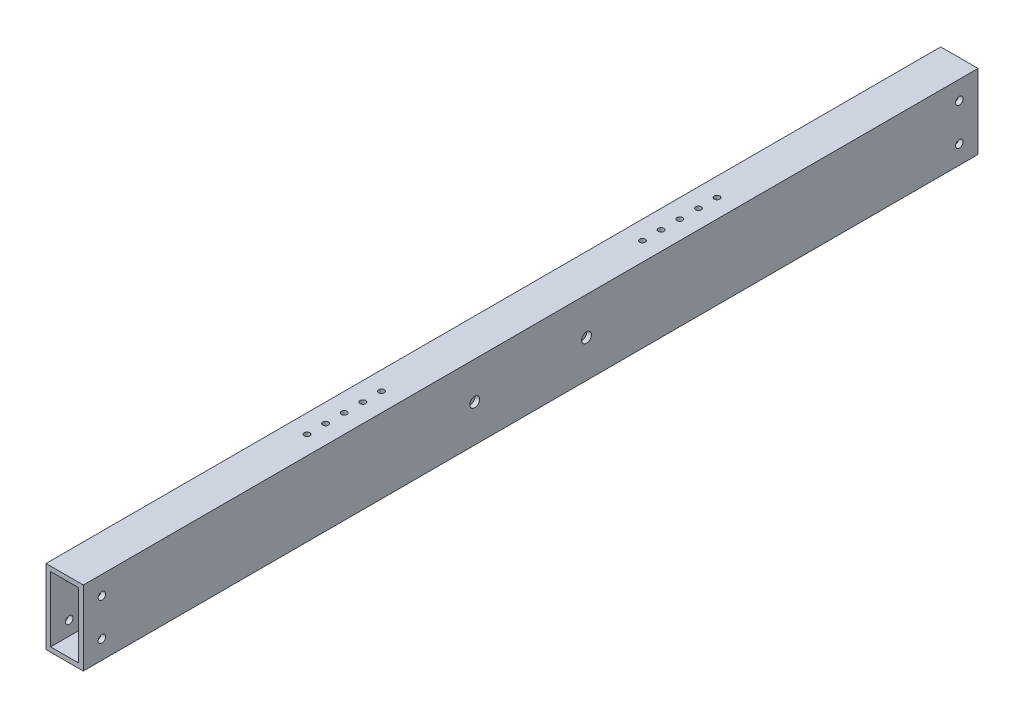
from build123d import *

# Parameters (mm, degrees)
SKETCH1_W               = 25.4
SKETCH1_H               = 50.8
SKETCH1_W_2             = 19.05
SKETCH1_H_2             = 44.45
BOSS_EXTRUDE1_DEPTH     = 304.8
F_10_CLEARANCE_HOLE1_D  = 5.1054
F_1_4_CLEARANCE_HOLE2_D = 6.7564
SKETCH7_R               = 1.905
CUT_EXTRUDE1_DEPTH      = 310.265209812


with BuildPart() as part:
    # Sketch1 → Boss-Extrude1 (new, symmetric)
    with BuildSketch(Plane.XY):
        Rectangle(SKETCH1_W, SKETCH1_H)
        Rectangle(SKETCH1_W_2, SKETCH1_H_2, mode=Mode.SUBTRACT)
    extrude(amount=BOSS_EXTRUDE1_DEPTH, both=True)

    # #10 Clearance Hole1 (through all)
    with Locations(Plane(origin=(12.7, 0, 0), x_dir=(0, 0, -1), z_dir=(1, 0, 0))):
        with Locations((-292.1, 12.7), (-292.1, -12.7)):
            f_10_clearance_hole1 = Hole(F_10_CLEARANCE_HOLE1_D / 2)

    # Mirror1: #10 Clearance Hole1 across plane
    add(f_10_clearance_hole1.mirror(Plane.XY), mode=Mode.SUBTRACT)

    # 1/4 Clearance Hole2 (through all)
    with Locations(Plane(origin=(12.7, 0, 0), x_dir=(0, 0, -1), z_dir=(1, 0, 0))):
        with Locations((-38.1, 0), (38.1, 0)):
            Hole(F_1_4_CLEARANCE_HOLE2_D / 2)

    # Sketch7 → Cut-Extrude1 (cut, through all)
    with BuildSketch(Plane(origin=(0, 25.4, 0), x_dir=(1, 0, 0), z_dir=(0, 1, 0))):
        with Locations((0, 139.7)):
            Circle(SKETCH7_R)
        with Locations((0, 127)):
            Circle(SKETCH7_R)
        with Locations((0, 114.3)):
            Circle(SKETCH7_R)
        with Locations((0, 101.6)):
            Circle(SKETCH7_R)
        with Locations((0, 88.9)):
            Circle(SKETCH7_R)
    cut_extrude1 = extrude(amount=-CUT_EXTRUDE1_DEPTH, mode=Mode.SUBTRACT)

    # Mirror2: Cut-Extrude1 across plane
    add(cut_extrude1.mirror(Plane.XY), mode=Mode.SUBTRACT)


solid = part.part
